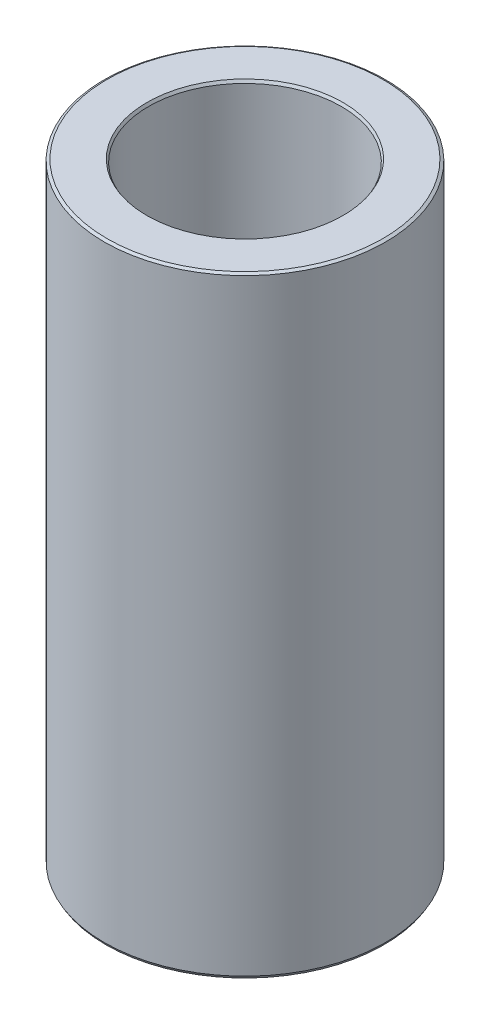
from build123d import *
from OCP.BRepFilletAPI import BRepFilletAPI_MakeChamfer

# Parameters (mm, degrees)
SKETCH1_R           = 25
BOSS_EXTRUDE1_DEPTH = 108.605377156
SKETCH2_R           = 17.148526708
CUT_EXTRUDE1_DEPTH  = 115.215270201
CHAMFER1_SIZE       = 0.279958672
CHAMFER1_SIZE2      = 0.484902644


with BuildPart() as part:
    # Sketch1 → Boss-Extrude1 (new body)
    with BuildSketch(Plane(origin=(0, 0, 0), x_dir=(1, 0, 0), z_dir=(0, 1, 0))):
        Circle(SKETCH1_R)
    extrude(amount=BOSS_EXTRUDE1_DEPTH)

    # Sketch2 → Cut-Extrude1 (cut, through all)
    with BuildSketch(Plane(origin=(0, 0, 0), x_dir=(1, 0, 0), z_dir=(0, 1, 0))):
        Circle(SKETCH2_R)
    extrude(amount=CUT_EXTRUDE1_DEPTH, mode=Mode.SUBTRACT)

    # Chamfer1: one chamfer whose edges measure the first distance from different faces: ONE call of the kernel's chamfer builder (chamfer() names one face for all edges)
    chamfer1_edges_1 = [part.edges().sort_by_distance(p)[0] for p in [
        (-17.148526708, 108.605377156, 0),
    ]]
    chamfer1_side_1 = [part.faces().sort_by_distance(p)[0] for p in [
        (-24.292893219, 108.605377156, 0),
    ]]
    chamfer1_edges_2 = [part.edges().sort_by_distance(p)[0] for p in [
        (-17.148526708, 0, 0),
    ]]
    chamfer1_side_2 = [part.faces().sort_by_distance(p)[0] for p in [
        (-17.148526708, 54.302688578, 0),
    ]]
    chamfer1_edges_3 = [part.edges().sort_by_distance(p)[0] for p in [
        (-25, 0, 0),
    ]]
    chamfer1_side_3 = [part.faces().sort_by_distance(p)[0] for p in [
        (-24.292893219, 0, 0),
    ]]
    chamfer1_edges_4 = [part.edges().sort_by_distance(p)[0] for p in [
        (-25, 108.605377156, 0),
    ]]
    chamfer1_side_4 = [part.faces().sort_by_distance(p)[0] for p in [
        (-25, 54.302688578, 0),
    ]]
    chamfer1 = BRepFilletAPI_MakeChamfer(part.part.solid().wrapped)
    for e in chamfer1_edges_1:
        chamfer1.Add(CHAMFER1_SIZE, CHAMFER1_SIZE2, e.wrapped, chamfer1_side_1[0].wrapped)  # the first distance lies on this face
    for e in chamfer1_edges_2:
        chamfer1.Add(CHAMFER1_SIZE, CHAMFER1_SIZE2, e.wrapped, chamfer1_side_2[0].wrapped)  # the first distance lies on this face
    for e in chamfer1_edges_3:
        chamfer1.Add(CHAMFER1_SIZE, CHAMFER1_SIZE2, e.wrapped, chamfer1_side_3[0].wrapped)  # the first distance lies on this face
    for e in chamfer1_edges_4:
        chamfer1.Add(CHAMFER1_SIZE, CHAMFER1_SIZE2, e.wrapped, chamfer1_side_4[0].wrapped)  # the first distance lies on this face
    add(Compound.cast(chamfer1.Shape()), mode=Mode.REPLACE)


solid = part.part
